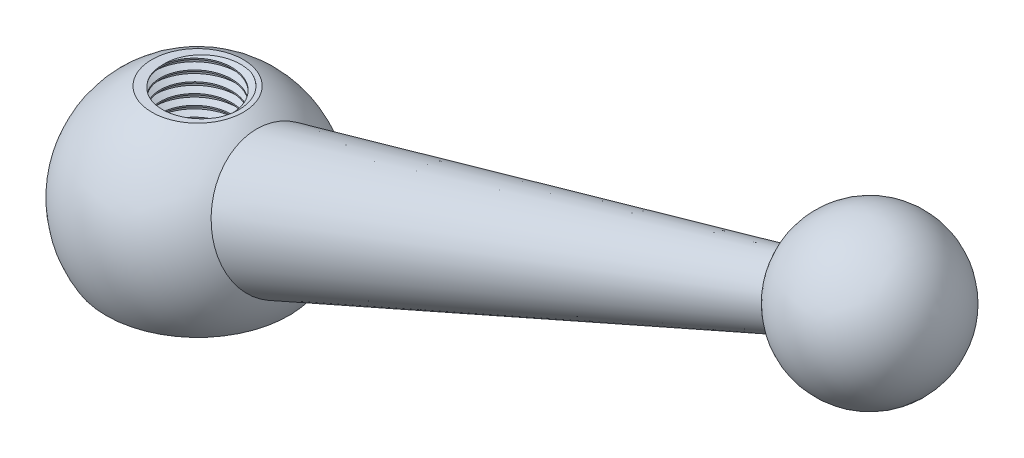
from build123d import *

# Parameters (mm, degrees)
CUT_EXTRUDE1_DEPTH      = 161.854572858
CUT_EXTRUDE1_DEPTH_BACK = 161.854572858
SKETCH2_W               = 47.842431936
SKETCH2_H               = 11.932500926
SKETCH2_W_2             = 43.623456918
SKETCH2_H_2             = 6.652327691
M16X2_0_TAPPED_HOLE1_D  = 14
THREAD1_PITCH           = 2


with BuildPart() as part:
    # Sketch1 one side → Revolve1 (revolve)
    with BuildSketch(Plane.XY, mode=Mode.PRIVATE) as revolve1_sk:
        with BuildLine():
            Line((-19.733545037, -7.18242301), (19.733545037, 7.18242301))
            Line((19.733545037, 7.18242301), (117.461577598, 42.752517916))
            Line((117.461577598, 42.752517916), (145.652356222, 53.013122215))
            ThreePointArc((145.652356222, 53.013122215), (129.414705716, 62.72905585), (116.586208356, 48.818976202))
            Line((116.586208356, 48.818976202), (11.581626135, 17.517589334))
            ThreePointArc((11.581626135, 17.517589334), (-13.005233481, 16.488295913), (-19.733545037, -7.18242301))
        make_face()
    revolve(revolve1_sk.sketch.rotate(Axis((0, 0, 0), (0.9396926207859082, 0.34202014332566943, 0)), 180), axis=Axis((0, 0, 0), (0.9396926207859082, 0.34202014332566943, 0)))

    # Sketch2 → Cut-Extrude1 (cut, two sides: drawn at the far end of the back side and taken through both)
    with BuildSketch(Plane.XY.offset(-CUT_EXTRUDE1_DEPTH_BACK)):
        with Locations((1.062006598, -16.966250463)):
            Rectangle(SKETCH2_W, SKETCH2_H)
        with Locations((-9.768757566, 22.326163845)):
            Rectangle(SKETCH2_W_2, SKETCH2_H_2)
    extrude(amount=CUT_EXTRUDE1_DEPTH + CUT_EXTRUDE1_DEPTH_BACK, mode=Mode.SUBTRACT)

    # M16x2.0 Tapped Hole1 (through all)
    with Locations(Plane(origin=(0, -11, 0), x_dir=(-1, 0, 0), z_dir=(0, -1, 0))):
        with Locations((0, 0)):
            Hole(M16X2_0_TAPPED_HOLE1_D / 2)

    # Thread1: the profile of Thread Profile1 profile screwed along a right-hand helix of 20 turns, 10 arcs to a turn; built about Z, then put on its axis
    thread1_z = Axis((0, 0, 0), (0, 0, 1))
    thread1_corners = [(6.9997, 0, -0.000173205), (6.9997, 0, 1.7501732), (8.08253175, 0, 1.124999997), (8.08253175, 0, 0.624999997)]
    with BuildLine(mode=Mode.PRIVATE) as thread1_profile:
        Line(thread1_corners[0], thread1_corners[1])
        Line(thread1_corners[1], thread1_corners[2])
        Line(thread1_corners[2], thread1_corners[3])
        Line(thread1_corners[3], thread1_corners[0])
    thread1_cap = Face(thread1_profile.wire())
    thread1_turn_angles = [0, 18, 36, 54, 72, 90, 108, 126, 144, 162, 180, 198, 216, 234, 252, 270, 288, 306, 324, 342, 360]
    thread1_turn_weights = [1, 0.9510565162951535, 1, 0.9510565162951535, 1, 0.9510565162951535, 1, 0.9510565162951535, 1, 0.9510565162951535, 1, 0.9510565162951535, 1, 0.9510565162951535, 1, 0.9510565162951535, 1, 0.9510565162951535, 1, 0.9510565162951535, 1]
    thread1_turn_rails = [Edge.make_bspline([Vector(p[0], p[1], 0).rotate(thread1_z, thread1_turn_angles[k]) / thread1_turn_weights[k] + Vector(0, 0, p[2] + THREAD1_PITCH * thread1_turn_angles[k] / 360) for k in range(21)], [0, 0, 0, 1, 1, 2, 2, 3, 3, 4, 4, 5, 5, 6, 6, 7, 7, 8, 8, 9, 9, 10, 10, 10], 2, thread1_turn_weights) for p in thread1_corners]
    thread1_turn_sides = [Face.make_surface_from_curves(thread1_turn_rails[p[0]], thread1_turn_rails[p[1]]) for p in [(0, 1), (1, 2), (2, 3), (3, 0)]]
    thread1 = Plane(origin=(0, -16, 0), x_dir=(1, 0, 0), z_dir=(0, 1, 0)) * Solid(Shell([*[p.moved(Location((0, 0, THREAD1_PITCH * i))) for i in range(20) for p in thread1_turn_sides], thread1_cap, thread1_cap.rotate(thread1_z, 7200).moved(Location((0, 0, THREAD1_PITCH * 7200 / 360)))]))
    add(thread1, mode=Mode.SUBTRACT)


solid = part.part
